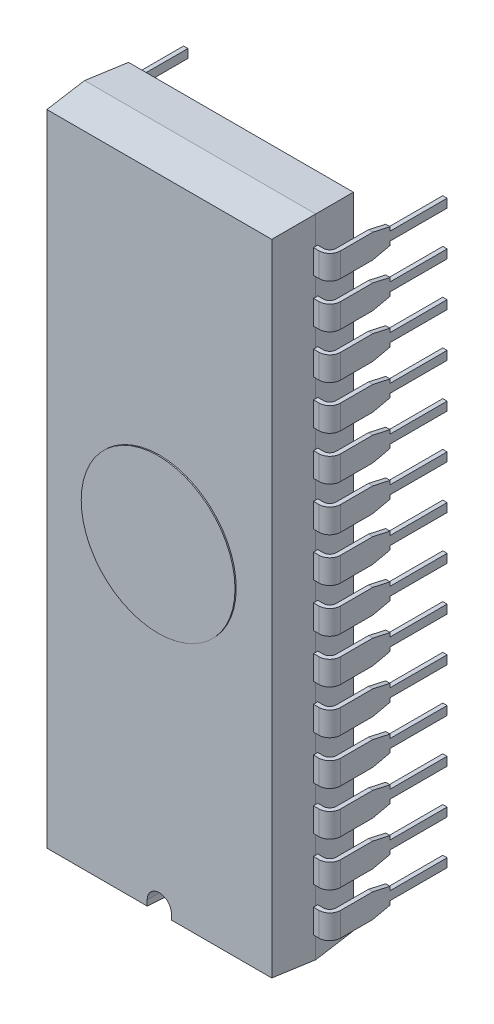
from build123d import *

# Parameters (mm, degrees)
BASIC_SHAPE_DEPTH               = 18.67
SIDE_PROFILE1_DEPTH             = 21.6375798
SIDE_PROFILE1_DEPTH_BACK        = 21.6375798
SIDE_PROFILE2_DEPTH             = 21.6375798
SIDE_PROFILE2_DEPTH_BACK        = 21.6375798
SKETCH6_W                       = 0.25
SKETCH6_H                       = 1.39
PIN_RELIEF_DEPTH                = 25.054804177
REMAINING_PINS_COUNT            = 14
REMAINING_PINS_PITCH            = 2.54
REMAINING_PINS_COPY_1_SKETCH_W  = 0.25
REMAINING_PINS_COPY_1_SKETCH_H  = 1.39
REMAINING_PINS_COPY_2_SKETCH_W  = 0.25
REMAINING_PINS_COPY_2_SKETCH_H  = 1.39
REMAINING_PINS_COPY_3_SKETCH_W  = 0.25
REMAINING_PINS_COPY_3_SKETCH_H  = 1.39
REMAINING_PINS_COPY_4_SKETCH_W  = 0.25
REMAINING_PINS_COPY_4_SKETCH_H  = 1.39
REMAINING_PINS_COPY_5_SKETCH_W  = 0.25
REMAINING_PINS_COPY_5_SKETCH_H  = 1.39
REMAINING_PINS_COPY_6_SKETCH_W  = 0.25
REMAINING_PINS_COPY_6_SKETCH_H  = 1.39
REMAINING_PINS_COPY_7_SKETCH_W  = 0.25
REMAINING_PINS_COPY_7_SKETCH_H  = 1.39
REMAINING_PINS_COPY_8_SKETCH_W  = 0.25
REMAINING_PINS_COPY_8_SKETCH_H  = 1.39
REMAINING_PINS_COPY_9_SKETCH_W  = 0.25
REMAINING_PINS_COPY_9_SKETCH_H  = 1.39
REMAINING_PINS_COPY_10_SKETCH_W = 0.25
REMAINING_PINS_COPY_10_SKETCH_H = 1.39
REMAINING_PINS_COPY_11_SKETCH_W = 0.25
REMAINING_PINS_COPY_11_SKETCH_H = 1.39
REMAINING_PINS_COPY_12_SKETCH_W = 0.25
REMAINING_PINS_COPY_12_SKETCH_H = 1.39
REMAINING_PINS_COPY_13_SKETCH_W = 0.25
REMAINING_PINS_COPY_13_SKETCH_H = 1.39
REMAINING_PINS_COPY_14_DEPTH    = 25.054804177
REMAINING_PINS_COPY_15_DEPTH    = 25.054804177
REMAINING_PINS_COPY_16_DEPTH    = 25.054804177
REMAINING_PINS_COPY_17_DEPTH    = 25.054804177
REMAINING_PINS_COPY_18_DEPTH    = 25.054804177
REMAINING_PINS_COPY_19_DEPTH    = 25.054804177
REMAINING_PINS_COPY_20_DEPTH    = 25.054804177
REMAINING_PINS_COPY_21_DEPTH    = 25.054804177
REMAINING_PINS_COPY_22_DEPTH    = 25.054804177
REMAINING_PINS_COPY_23_DEPTH    = 25.054804177
REMAINING_PINS_COPY_24_DEPTH    = 25.054804177
REMAINING_PINS_COPY_25_DEPTH    = 25.054804177
REMAINING_PINS_COPY_26_DEPTH    = 25.054804177
WINDOW_START                    = 5.72
WINDOW_OUTLINE_R                = 4.445
WINDOW_DEPTH                    = 0.07
LOCATION_MARK_DEPTH             = 23.089889633


# Read off the part's stored shape, not the designer's step: Window
with BuildPart() as part:
    # Sketch1 → Basic Shape (new, symmetric)
    with BuildSketch(Plane(origin=(0, 0, 0), x_dir=(1, 0, 0), z_dir=(0, 1, 0))):
        Polygon((-6.5, -5.72), (-6.68, -3.36), (-6.5, -1), (6.5, -1), (6.68, -3.36), (6.5, -5.72), align=None)
    extrude(amount=BASIC_SHAPE_DEPTH, both=True)

    # Sketch2 → Side Profile1 (cut, two sides: drawn at the far end of the back side and taken through both)
    with BuildSketch(Plane(origin=(0, 0, 0), x_dir=(0, 0, -1), z_dir=(1, 0, 0)).offset(-SIDE_PROFILE1_DEPTH_BACK)):
        Polygon((-1, 18.67), (-1, 18.49), (-3.36, 18.67), align=None)
        Polygon((-1, -18.67), (-3.36, -18.67), (-1, -18.49), align=None)
    extrude(amount=SIDE_PROFILE1_DEPTH + SIDE_PROFILE1_DEPTH_BACK, mode=Mode.SUBTRACT)

    # Sketch3 → Side Profile2 (cut, two sides: drawn at the far end of the back side and taken through both)
    with BuildSketch(Plane(origin=(0, 0, 0), x_dir=(0, 0, -1), z_dir=(1, 0, 0)).offset(-SIDE_PROFILE2_DEPTH_BACK)):
        Polygon((-3.36, 18.67), (-5.72, 18.67), (-5.72, 18.49), align=None)
        Polygon((-3.36, -18.67), (-5.72, -18.67), (-5.72, -18.49), align=None)
    extrude(amount=SIDE_PROFILE2_DEPTH + SIDE_PROFILE2_DEPTH_BACK, mode=Mode.SUBTRACT)

    # First Pin: sweep along a path in Sketch5
    with BuildLine(Plane(origin=(0, -16.67, 0), x_dir=(1, 0, 0), z_dir=(0, 1, 0))) as first_pin_path:
        Line((0, -3.36), (6.993, -3.36))
        ThreePointArc((6.993, -3.36), (7.346553391, -3.213553391), (7.493, -2.86))
        Line((7.493, -2.86), (7.493, 3.3))
    # Sketch6 → First Pin (sweep)
    with BuildSketch(Plane(origin=(0, 0, 0), x_dir=(0, 0, -1), z_dir=(1, 0, 0))):
        with Locations((-3.36, -16.67)):
            Rectangle(SKETCH6_W, SKETCH6_H)
    first_pin = sweep(path=first_pin_path.line)

    # Sketch7 → Pin Relief (cut, through all)
    with BuildSketch(Plane.ZY.offset(-7.368)):
        Polygon((-3.3, -16.92), (0, -16.92), (0, -17.1425), (1, -17.365), (-3.3, -17.365), align=None)
        Polygon((-3.3, -16.42), (0, -16.42), (0, -16.1975), (1, -15.975), (-3.3, -15.975), align=None)
    pin_relief = extrude(amount=-PIN_RELIEF_DEPTH, mode=Mode.SUBTRACT)

    # Opp Pin: First Pin, Pin Relief across plane
    add(first_pin.mirror(Plane(origin=(0, 0, 0), x_dir=(0, 0, 1), z_dir=(1, 0, 0))))
    add(pin_relief.mirror(Plane(origin=(0, 0, 0), x_dir=(0, 0, 1), z_dir=(1, 0, 0))), mode=Mode.SUBTRACT)

    # Remaining Pins: First Pin, Pin Relief ×14
    with Locations(*[(0, i * REMAINING_PINS_PITCH, 0) for i in range(1, REMAINING_PINS_COUNT)]):
        add(first_pin)
        add(pin_relief, mode=Mode.SUBTRACT)

    # Remaining Pins copy 1: sweep along a path in Remaining Pins copy 1 path
    with BuildLine(Plane(origin=(0, -14.13, 0), x_dir=(-1, 0, 0), z_dir=(0, 1, 0))) as remaining_pins_copy_1_path:
        Line((0, 3.36), (6.993, 3.36))
        ThreePointArc((6.993, 3.36), (7.346553391, 3.213553391), (7.493, 2.86))
        Line((7.493, 2.86), (7.493, -3.3))
    # Remaining Pins copy 1 sketch → Remaining Pins copy 1 (sweep)
    with BuildSketch(Plane(origin=(0, 2.54, 0), x_dir=(0, 0, -1), z_dir=(-1, 0, 0))):
        with Locations((-3.36, 16.67)):
            Rectangle(REMAINING_PINS_COPY_1_SKETCH_W, REMAINING_PINS_COPY_1_SKETCH_H)
    sweep(path=remaining_pins_copy_1_path.line)

    # Remaining Pins copy 2: sweep along a path in Remaining Pins copy 2 path
    with BuildLine(Plane(origin=(0, -11.59, 0), x_dir=(-1, 0, 0), z_dir=(0, 1, 0))) as remaining_pins_copy_2_path:
        Line((0, 3.36), (6.993, 3.36))
        ThreePointArc((6.993, 3.36), (7.346553391, 3.213553391), (7.493, 2.86))
        Line((7.493, 2.86), (7.493, -3.3))
    # Remaining Pins copy 2 sketch → Remaining Pins copy 2 (sweep)
    with BuildSketch(Plane(origin=(0, 5.08, 0), x_dir=(0, 0, -1), z_dir=(-1, 0, 0))):
        with Locations((-3.36, 16.67)):
            Rectangle(REMAINING_PINS_COPY_2_SKETCH_W, REMAINING_PINS_COPY_2_SKETCH_H)
    sweep(path=remaining_pins_copy_2_path.line)

    # Remaining Pins copy 3: sweep along a path in Remaining Pins copy 3 path
    with BuildLine(Plane(origin=(0, -9.05, 0), x_dir=(-1, 0, 0), z_dir=(0, 1, 0))) as remaining_pins_copy_3_path:
        Line((0, 3.36), (6.993, 3.36))
        ThreePointArc((6.993, 3.36), (7.346553391, 3.213553391), (7.493, 2.86))
        Line((7.493, 2.86), (7.493, -3.3))
    # Remaining Pins copy 3 sketch → Remaining Pins copy 3 (sweep)
    with BuildSketch(Plane(origin=(0, 7.62, 0), x_dir=(0, 0, -1), z_dir=(-1, 0, 0))):
        with Locations((-3.36, 16.67)):
            Rectangle(REMAINING_PINS_COPY_3_SKETCH_W, REMAINING_PINS_COPY_3_SKETCH_H)
    sweep(path=remaining_pins_copy_3_path.line)

    # Remaining Pins copy 4: sweep along a path in Remaining Pins copy 4 path
    with BuildLine(Plane(origin=(0, -6.51, 0), x_dir=(-1, 0, 0), z_dir=(0, 1, 0))) as remaining_pins_copy_4_path:
        Line((0, 3.36), (6.993, 3.36))
        ThreePointArc((6.993, 3.36), (7.346553391, 3.213553391), (7.493, 2.86))
        Line((7.493, 2.86), (7.493, -3.3))
    # Remaining Pins copy 4 sketch → Remaining Pins copy 4 (sweep)
    with BuildSketch(Plane(origin=(0, 10.16, 0), x_dir=(0, 0, -1), z_dir=(-1, 0, 0))):
        with Locations((-3.36, 16.67)):
            Rectangle(REMAINING_PINS_COPY_4_SKETCH_W, REMAINING_PINS_COPY_4_SKETCH_H)
    sweep(path=remaining_pins_copy_4_path.line)

    # Remaining Pins copy 5: sweep along a path in Remaining Pins copy 5 path
    with BuildLine(Plane(origin=(0, -3.97, 0), x_dir=(-1, 0, 0), z_dir=(0, 1, 0))) as remaining_pins_copy_5_path:
        Line((0, 3.36), (6.993, 3.36))
        ThreePointArc((6.993, 3.36), (7.346553391, 3.213553391), (7.493, 2.86))
        Line((7.493, 2.86), (7.493, -3.3))
    # Remaining Pins copy 5 sketch → Remaining Pins copy 5 (sweep)
    with BuildSketch(Plane(origin=(0, 12.7, 0), x_dir=(0, 0, -1), z_dir=(-1, 0, 0))):
        with Locations((-3.36, 16.67)):
            Rectangle(REMAINING_PINS_COPY_5_SKETCH_W, REMAINING_PINS_COPY_5_SKETCH_H)
    sweep(path=remaining_pins_copy_5_path.line)

    # Remaining Pins copy 6: sweep along a path in Remaining Pins copy 6 path
    with BuildLine(Plane(origin=(0, -1.43, 0), x_dir=(-1, 0, 0), z_dir=(0, 1, 0))) as remaining_pins_copy_6_path:
        Line((0, 3.36), (6.993, 3.36))
        ThreePointArc((6.993, 3.36), (7.346553391, 3.213553391), (7.493, 2.86))
        Line((7.493, 2.86), (7.493, -3.3))
    # Remaining Pins copy 6 sketch → Remaining Pins copy 6 (sweep)
    with BuildSketch(Plane(origin=(0, 15.24, 0), x_dir=(0, 0, -1), z_dir=(-1, 0, 0))):
        with Locations((-3.36, 16.67)):
            Rectangle(REMAINING_PINS_COPY_6_SKETCH_W, REMAINING_PINS_COPY_6_SKETCH_H)
    sweep(path=remaining_pins_copy_6_path.line)

    # Remaining Pins copy 7: sweep along a path in Remaining Pins copy 7 path
    with BuildLine(Plane(origin=(0, 1.11, 0), x_dir=(-1, 0, 0), z_dir=(0, 1, 0))) as remaining_pins_copy_7_path:
        Line((0, 3.36), (6.993, 3.36))
        ThreePointArc((6.993, 3.36), (7.346553391, 3.213553391), (7.493, 2.86))
        Line((7.493, 2.86), (7.493, -3.3))
    # Remaining Pins copy 7 sketch → Remaining Pins copy 7 (sweep)
    with BuildSketch(Plane(origin=(0, 17.78, 0), x_dir=(0, 0, -1), z_dir=(-1, 0, 0))):
        with Locations((-3.36, 16.67)):
            Rectangle(REMAINING_PINS_COPY_7_SKETCH_W, REMAINING_PINS_COPY_7_SKETCH_H)
    sweep(path=remaining_pins_copy_7_path.line)

    # Remaining Pins copy 8: sweep along a path in Remaining Pins copy 8 path
    with BuildLine(Plane(origin=(0, 3.65, 0), x_dir=(-1, 0, 0), z_dir=(0, 1, 0))) as remaining_pins_copy_8_path:
        Line((0, 3.36), (6.993, 3.36))
        ThreePointArc((6.993, 3.36), (7.346553391, 3.213553391), (7.493, 2.86))
        Line((7.493, 2.86), (7.493, -3.3))
    # Remaining Pins copy 8 sketch → Remaining Pins copy 8 (sweep)
    with BuildSketch(Plane(origin=(0, 20.32, 0), x_dir=(0, 0, -1), z_dir=(-1, 0, 0))):
        with Locations((-3.36, 16.67)):
            Rectangle(REMAINING_PINS_COPY_8_SKETCH_W, REMAINING_PINS_COPY_8_SKETCH_H)
    sweep(path=remaining_pins_copy_8_path.line)

    # Remaining Pins copy 9: sweep along a path in Remaining Pins copy 9 path
    with BuildLine(Plane(origin=(0, 6.19, 0), x_dir=(-1, 0, 0), z_dir=(0, 1, 0))) as remaining_pins_copy_9_path:
        Line((0, 3.36), (6.993, 3.36))
        ThreePointArc((6.993, 3.36), (7.346553391, 3.213553391), (7.493, 2.86))
        Line((7.493, 2.86), (7.493, -3.3))
    # Remaining Pins copy 9 sketch → Remaining Pins copy 9 (sweep)
    with BuildSketch(Plane(origin=(0, 22.86, 0), x_dir=(0, 0, -1), z_dir=(-1, 0, 0))):
        with Locations((-3.36, 16.67)):
            Rectangle(REMAINING_PINS_COPY_9_SKETCH_W, REMAINING_PINS_COPY_9_SKETCH_H)
    sweep(path=remaining_pins_copy_9_path.line)

    # Remaining Pins copy 10: sweep along a path in Remaining Pins copy 10 path
    with BuildLine(Plane(origin=(0, 8.73, 0), x_dir=(-1, 0, 0), z_dir=(0, 1, 0))) as remaining_pins_copy_10_path:
        Line((0, 3.36), (6.993, 3.36))
        ThreePointArc((6.993, 3.36), (7.346553391, 3.213553391), (7.493, 2.86))
        Line((7.493, 2.86), (7.493, -3.3))
    # Remaining Pins copy 10 sketch → Remaining Pins copy 10 (sweep)
    with BuildSketch(Plane(origin=(0, 25.4, 0), x_dir=(0, 0, -1), z_dir=(-1, 0, 0))):
        with Locations((-3.36, 16.67)):
            Rectangle(REMAINING_PINS_COPY_10_SKETCH_W, REMAINING_PINS_COPY_10_SKETCH_H)
    sweep(path=remaining_pins_copy_10_path.line)

    # Remaining Pins copy 11: sweep along a path in Remaining Pins copy 11 path
    with BuildLine(Plane(origin=(0, 11.27, 0), x_dir=(-1, 0, 0), z_dir=(0, 1, 0))) as remaining_pins_copy_11_path:
        Line((0, 3.36), (6.993, 3.36))
        ThreePointArc((6.993, 3.36), (7.346553391, 3.213553391), (7.493, 2.86))
        Line((7.493, 2.86), (7.493, -3.3))
    # Remaining Pins copy 11 sketch → Remaining Pins copy 11 (sweep)
    with BuildSketch(Plane(origin=(0, 27.94, 0), x_dir=(0, 0, -1), z_dir=(-1, 0, 0))):
        with Locations((-3.36, 16.67)):
            Rectangle(REMAINING_PINS_COPY_11_SKETCH_W, REMAINING_PINS_COPY_11_SKETCH_H)
    sweep(path=remaining_pins_copy_11_path.line)

    # Remaining Pins copy 12: sweep along a path in Remaining Pins copy 12 path
    with BuildLine(Plane(origin=(0, 13.81, 0), x_dir=(-1, 0, 0), z_dir=(0, 1, 0))) as remaining_pins_copy_12_path:
        Line((0, 3.36), (6.993, 3.36))
        ThreePointArc((6.993, 3.36), (7.346553391, 3.213553391), (7.493, 2.86))
        Line((7.493, 2.86), (7.493, -3.3))
    # Remaining Pins copy 12 sketch → Remaining Pins copy 12 (sweep)
    with BuildSketch(Plane(origin=(0, 30.48, 0), x_dir=(0, 0, -1), z_dir=(-1, 0, 0))):
        with Locations((-3.36, 16.67)):
            Rectangle(REMAINING_PINS_COPY_12_SKETCH_W, REMAINING_PINS_COPY_12_SKETCH_H)
    sweep(path=remaining_pins_copy_12_path.line)

    # Remaining Pins copy 13: sweep along a path in Remaining Pins copy 13 path
    with BuildLine(Plane(origin=(0, 16.35, 0), x_dir=(-1, 0, 0), z_dir=(0, 1, 0))) as remaining_pins_copy_13_path:
        Line((0, 3.36), (6.993, 3.36))
        ThreePointArc((6.993, 3.36), (7.346553391, 3.213553391), (7.493, 2.86))
        Line((7.493, 2.86), (7.493, -3.3))
    # Remaining Pins copy 13 sketch → Remaining Pins copy 13 (sweep)
    with BuildSketch(Plane(origin=(0, 33.02, 0), x_dir=(0, 0, -1), z_dir=(-1, 0, 0))):
        with Locations((-3.36, 16.67)):
            Rectangle(REMAINING_PINS_COPY_13_SKETCH_W, REMAINING_PINS_COPY_13_SKETCH_H)
    sweep(path=remaining_pins_copy_13_path.line)

    # Remaining Pins copy 14 sketch → Remaining Pins copy 14 (cut, through all)
    with BuildSketch(Plane(origin=(-7.368, 2.54, 0), x_dir=(0, 0, 1), z_dir=(1, 0, 0))):
        Polygon((-3.3, 16.92), (0, 16.92), (0, 17.1425), (1, 17.365), (-3.3, 17.365), align=None)
        Polygon((-3.3, 16.42), (0, 16.42), (0, 16.1975), (1, 15.975), (-3.3, 15.975), align=None)
    extrude(amount=-REMAINING_PINS_COPY_14_DEPTH, mode=Mode.SUBTRACT)

    # Remaining Pins copy 15 sketch → Remaining Pins copy 15 (cut, through all)
    with BuildSketch(Plane(origin=(-7.368, 5.08, 0), x_dir=(0, 0, 1), z_dir=(1, 0, 0))):
        Polygon((-3.3, 16.92), (0, 16.92), (0, 17.1425), (1, 17.365), (-3.3, 17.365), align=None)
        Polygon((-3.3, 16.42), (0, 16.42), (0, 16.1975), (1, 15.975), (-3.3, 15.975), align=None)
    extrude(amount=-REMAINING_PINS_COPY_15_DEPTH, mode=Mode.SUBTRACT)

    # Remaining Pins copy 16 sketch → Remaining Pins copy 16 (cut, through all)
    with BuildSketch(Plane(origin=(-7.368, 7.62, 0), x_dir=(0, 0, 1), z_dir=(1, 0, 0))):
        Polygon((-3.3, 16.92), (0, 16.92), (0, 17.1425), (1, 17.365), (-3.3, 17.365), align=None)
        Polygon((-3.3, 16.42), (0, 16.42), (0, 16.1975), (1, 15.975), (-3.3, 15.975), align=None)
    extrude(amount=-REMAINING_PINS_COPY_16_DEPTH, mode=Mode.SUBTRACT)

    # Remaining Pins copy 17 sketch → Remaining Pins copy 17 (cut, through all)
    with BuildSketch(Plane(origin=(-7.368, 10.16, 0), x_dir=(0, 0, 1), z_dir=(1, 0, 0))):
        Polygon((-3.3, 16.92), (0, 16.92), (0, 17.1425), (1, 17.365), (-3.3, 17.365), align=None)
        Polygon((-3.3, 16.42), (0, 16.42), (0, 16.1975), (1, 15.975), (-3.3, 15.975), align=None)
    extrude(amount=-REMAINING_PINS_COPY_17_DEPTH, mode=Mode.SUBTRACT)

    # Remaining Pins copy 18 sketch → Remaining Pins copy 18 (cut, through all)
    with BuildSketch(Plane(origin=(-7.368, 12.7, 0), x_dir=(0, 0, 1), z_dir=(1, 0, 0))):
        Polygon((-3.3, 16.92), (0, 16.92), (0, 17.1425), (1, 17.365), (-3.3, 17.365), align=None)
        Polygon((-3.3, 16.42), (0, 16.42), (0, 16.1975), (1, 15.975), (-3.3, 15.975), align=None)
    extrude(amount=-REMAINING_PINS_COPY_18_DEPTH, mode=Mode.SUBTRACT)

    # Remaining Pins copy 19 sketch → Remaining Pins copy 19 (cut, through all)
    with BuildSketch(Plane(origin=(-7.368, 15.24, 0), x_dir=(0, 0, 1), z_dir=(1, 0, 0))):
        Polygon((-3.3, 16.92), (0, 16.92), (0, 17.1425), (1, 17.365), (-3.3, 17.365), align=None)
        Polygon((-3.3, 16.42), (0, 16.42), (0, 16.1975), (1, 15.975), (-3.3, 15.975), align=None)
    extrude(amount=-REMAINING_PINS_COPY_19_DEPTH, mode=Mode.SUBTRACT)

    # Remaining Pins copy 20 sketch → Remaining Pins copy 20 (cut, through all)
    with BuildSketch(Plane(origin=(-7.368, 17.78, 0), x_dir=(0, 0, 1), z_dir=(1, 0, 0))):
        Polygon((-3.3, 16.92), (0, 16.92), (0, 17.1425), (1, 17.365), (-3.3, 17.365), align=None)
        Polygon((-3.3, 16.42), (0, 16.42), (0, 16.1975), (1, 15.975), (-3.3, 15.975), align=None)
    extrude(amount=-REMAINING_PINS_COPY_20_DEPTH, mode=Mode.SUBTRACT)

    # Remaining Pins copy 21 sketch → Remaining Pins copy 21 (cut, through all)
    with BuildSketch(Plane(origin=(-7.368, 20.32, 0), x_dir=(0, 0, 1), z_dir=(1, 0, 0))):
        Polygon((-3.3, 16.92), (0, 16.92), (0, 17.1425), (1, 17.365), (-3.3, 17.365), align=None)
        Polygon((-3.3, 16.42), (0, 16.42), (0, 16.1975), (1, 15.975), (-3.3, 15.975), align=None)
    extrude(amount=-REMAINING_PINS_COPY_21_DEPTH, mode=Mode.SUBTRACT)

    # Remaining Pins copy 22 sketch → Remaining Pins copy 22 (cut, through all)
    with BuildSketch(Plane(origin=(-7.368, 22.86, 0), x_dir=(0, 0, 1), z_dir=(1, 0, 0))):
        Polygon((-3.3, 16.92), (0, 16.92), (0, 17.1425), (1, 17.365), (-3.3, 17.365), align=None)
        Polygon((-3.3, 16.42), (0, 16.42), (0, 16.1975), (1, 15.975), (-3.3, 15.975), align=None)
    extrude(amount=-REMAINING_PINS_COPY_22_DEPTH, mode=Mode.SUBTRACT)

    # Remaining Pins copy 23 sketch → Remaining Pins copy 23 (cut, through all)
    with BuildSketch(Plane(origin=(-7.368, 25.4, 0), x_dir=(0, 0, 1), z_dir=(1, 0, 0))):
        Polygon((-3.3, 16.92), (0, 16.92), (0, 17.1425), (1, 17.365), (-3.3, 17.365), align=None)
        Polygon((-3.3, 16.42), (0, 16.42), (0, 16.1975), (1, 15.975), (-3.3, 15.975), align=None)
    extrude(amount=-REMAINING_PINS_COPY_23_DEPTH, mode=Mode.SUBTRACT)

    # Remaining Pins copy 24 sketch → Remaining Pins copy 24 (cut, through all)
    with BuildSketch(Plane(origin=(-7.368, 27.94, 0), x_dir=(0, 0, 1), z_dir=(1, 0, 0))):
        Polygon((-3.3, 16.92), (0, 16.92), (0, 17.1425), (1, 17.365), (-3.3, 17.365), align=None)
        Polygon((-3.3, 16.42), (0, 16.42), (0, 16.1975), (1, 15.975), (-3.3, 15.975), align=None)
    extrude(amount=-REMAINING_PINS_COPY_24_DEPTH, mode=Mode.SUBTRACT)

    # Remaining Pins copy 25 sketch → Remaining Pins copy 25 (cut, through all)
    with BuildSketch(Plane(origin=(-7.368, 30.48, 0), x_dir=(0, 0, 1), z_dir=(1, 0, 0))):
        Polygon((-3.3, 16.92), (0, 16.92), (0, 17.1425), (1, 17.365), (-3.3, 17.365), align=None)
        Polygon((-3.3, 16.42), (0, 16.42), (0, 16.1975), (1, 15.975), (-3.3, 15.975), align=None)
    extrude(amount=-REMAINING_PINS_COPY_25_DEPTH, mode=Mode.SUBTRACT)

    # Remaining Pins copy 26 sketch → Remaining Pins copy 26 (cut, through all)
    with BuildSketch(Plane(origin=(-7.368, 33.02, 0), x_dir=(0, 0, 1), z_dir=(1, 0, 0))):
        Polygon((-3.3, 16.92), (0, 16.92), (0, 17.1425), (1, 17.365), (-3.3, 17.365), align=None)
        Polygon((-3.3, 16.42), (0, 16.42), (0, 16.1975), (1, 15.975), (-3.3, 15.975), align=None)
    extrude(amount=-REMAINING_PINS_COPY_26_DEPTH, mode=Mode.SUBTRACT)

    # Window outline → Window (add)
    with BuildSketch(Plane.XY.offset(WINDOW_START)):
        Circle(WINDOW_OUTLINE_R)
    extrude(amount=WINDOW_DEPTH)

    # Sketch4 → Location Mark (cut, through all)
    with BuildSketch(Plane.XY.offset(5.72)):
        with BuildLine():
            Line((-0.7, -18.67), (-0.7, -18.17))
            ThreePointArc((-0.7, -18.17), (0, -17.47), (0.7, -18.17))
            Line((0.7, -18.17), (0.7, -18.67))
            Line((0.7, -18.67), (-0.7, -18.67))
        make_face()
    extrude(amount=-LOCATION_MARK_DEPTH, mode=Mode.SUBTRACT)


solid = part.part
